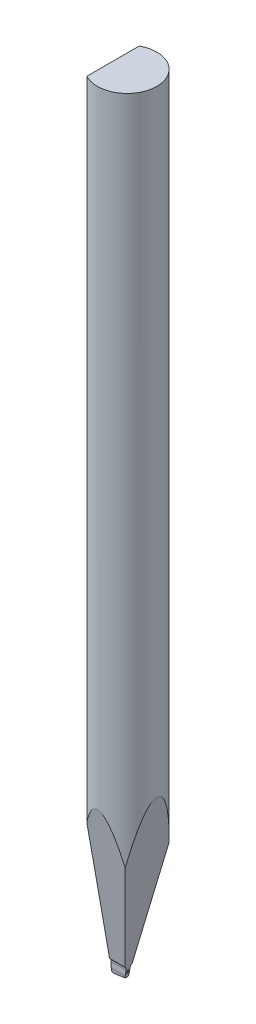
from build123d import *

# Parameters (mm, degrees)
TD_SKETCH_R                             = 0.79248
TL_FEATURE_DEPTH                        = 21.0312
TDF_STD_SKETCH_W                        = 2.09296
TDF_STD_SKETCH_H                        = 2.09296
TDF_STD_FEATURE_DEPTH                   = 22.061040395
ISA_20_STD_FEATURE_DEPTH                = 22.061040395
ISA_20_STD_FEATURE_DEPTH_BACK           = 22.061040395
VW_STD_FEATURE_DEPTH                    = 22.061040395
VW_STD_FEATURE_DEPTH_BACK               = 22.061040395
F_10BA_STD_FEATURE_DEPTH                = 22.061040503
F_10BA_STD_FEATURE_DEPTH_BACK           = 22.061040503
FRO_STD_FEATURE_DEPTH                   = 22.061040395
FRO_STD_FEATURE_DEPTH_BACK              = 22.061040395
C_STD_FEATURE_DEPTH                     = 22.061040395
C_STD_FEATURE_DEPTH_BACK                = 22.061040395
ERW_STD_FEATURE_DEPTH                   = 0.01905
H_STD_FEATURE_REACH                     = 22.896
H_STD_SKETCH_R                          = 0.01905
H_STD_SKETCH_3_R                        = 0.01905
FUNNEL_FINAL_DIAMETRE_STD_FEATURE_DEPTH = 2.499995
FUNNEL_FINAL_DIAMETRE_STD_FEATURE_DRAFT = -22.5
ROUND_BR_STD_FEATURE_START              = -1
ROUND_BR_STD_FEATURE_DEPTH              = 1.009339363


with BuildPart() as part:
    # TD_sketch → TL_feature (new body)
    with BuildSketch(Plane(origin=(0, 0, 0), x_dir=(1, 0, 0), z_dir=(0, 1, 0))):
        with Locations(Location((0, 0, 0), (0, 0, 270))):
            Circle(TD_SKETCH_R)
    extrude(amount=TL_FEATURE_DEPTH)

    # TDF_STD_sketch → TDF_STD_feature (cut, through all)
    with BuildSketch(Plane(origin=(0, 0, 0), x_dir=(1, 0, 0), z_dir=(0, 1, 0))):
        with Locations((-1.4224, 0)):
            Rectangle(TDF_STD_SKETCH_W, TDF_STD_SKETCH_H)
    extrude(amount=TDF_STD_FEATURE_DEPTH, mode=Mode.SUBTRACT)

    # ISA_20_STD_sketch → ISA_20_STD_feature (cut, two sides: drawn at the far end of the back side and taken through both)
    with BuildSketch(Plane(origin=(0, 0, 0), x_dir=(0, 0, -1), z_dir=(1, 0, 0)).offset(-ISA_20_STD_FEATURE_DEPTH_BACK)):
        Polygon((-12.946999885, 73.253224398), (-3.738847997, 21.0312), (-0.03048, 0), (0.03048, 0), (3.738847997, 21.0312), (12.946999885, 73.253224398), (12.946999885, -32.802042202), (-12.946999885, -32.802042202), align=None)
    extrude(amount=ISA_20_STD_FEATURE_DEPTH + ISA_20_STD_FEATURE_DEPTH_BACK, mode=Mode.SUBTRACT)

    # VW_STD_sketch → VW_STD_feature (cut, two sides: drawn at the far end of the back side and taken through both)
    with BuildSketch(Plane(origin=(0, 0, 0), x_dir=(0, 0, -1), z_dir=(1, 0, 0)).offset(-VW_STD_FEATURE_DEPTH_BACK)):
        with BuildLine():
            Line((-70.448918022, 70.704723144), (-20.775394878, 21.0312))
            Line((-20.775394878, 21.0312), (-0.087997439, 0.343802561))
            ThreePointArc((-0.087997439, 0.343802561), (-0.060467299, 0.302600796), (-0.0508, 0.254))
            Line((-0.0508, 0.254), (-0.0508, 0))
            Line((-0.0508, 0), (0.0508, 0))
            Line((0.0508, 0), (0.0508, 0.254))
            ThreePointArc((0.0508, 0.254), (0.060467299, 0.302600796), (0.087997439, 0.343802561))
            Line((0.087997439, 0.343802561), (20.775394878, 21.0312))
            Line((20.775394878, 21.0312), (70.448918022, 70.704723144))
            Line((70.448918022, 70.704723144), (70.448918022, -69.793217099))
            Line((70.448918022, -69.793217099), (-70.448918022, -69.793217099))
            Line((-70.448918022, -69.793217099), (-70.448918022, 70.704723144))
        make_face()
    extrude(amount=VW_STD_FEATURE_DEPTH + VW_STD_FEATURE_DEPTH_BACK, mode=Mode.SUBTRACT)

    # 10BA_STD_sketch → 10BA_STD_feature (cut, two sides: drawn at the far end of the back side and taken through both)
    with BuildSketch(Plane.XY.offset(-F_10BA_STD_FEATURE_DEPTH_BACK)):
        Polygon((-53.216424868, 0), (-0.37592, 0), (-0.29972, 0), (-0.011354365, 0.050846642), (3.688047997, 21.0312), (12.863705374, 73.068938867), (91.245890155, 2.183757568), (25.165759913, -70.885181299), align=None)
    extrude(amount=F_10BA_STD_FEATURE_DEPTH + F_10BA_STD_FEATURE_DEPTH_BACK, mode=Mode.SUBTRACT)

    # FRO_STD_sketch → FRO_STD_feature (cut, two sides: drawn at the far end of the back side and taken through both)
    with BuildSketch(Plane.XY.offset(-FRO_STD_FEATURE_DEPTH_BACK)):
        with BuildLine():
            Line((-0.37592, 52.152138388), (-0.37592, 0.02794))
            ThreePointArc((-0.37592, 0.02794), (-0.367736563, 0.008183437), (-0.34798, 0))
            Line((-0.34798, 0), (51.776218388, 0))
            Line((51.776218388, 0), (-21.9385299, -73.714748288))
            Line((-21.9385299, -73.714748288), (-74.090668288, -21.5626099))
            Line((-74.090668288, -21.5626099), (-0.37592, 52.152138388))
        make_face()
    extrude(amount=FRO_STD_FEATURE_DEPTH + FRO_STD_FEATURE_DEPTH_BACK, mode=Mode.SUBTRACT)

    # C_STD_sketch → C_STD_feature (cut, two sides: drawn at the far end of the back side and taken through both)
    with BuildSketch(Plane(origin=(0, 0, 0), x_dir=(0, 0, -1), z_dir=(1, 0, 0)).offset(-C_STD_FEATURE_DEPTH_BACK)):
        with BuildLine():
            Line((-50.530423385, -12.791040855), (-0.030559272, 0))
            ThreePointArc((-0.030559272, 0), (0, 0.00381), (0.030559272, 0))
            Line((0.030559272, 0), (50.530423385, -12.791040855))
            Line((50.530423385, -12.791040855), (50.530423385, -116.980234183))
            Line((50.530423385, -116.980234183), (-50.530423385, -116.980234183))
            Line((-50.530423385, -116.980234183), (-50.530423385, -12.791040855))
        make_face()
    extrude(amount=C_STD_FEATURE_DEPTH + C_STD_FEATURE_DEPTH_BACK, mode=Mode.SUBTRACT)


with BuildPart() as body_2:
    # ERW_STD_sketch → ERW_STD_feature (new, symmetric)
    with BuildSketch(Plane.XY):
        Polygon((-0.1397, 0.09144), (-0.1397, 0), (-0.32512, 0), (-0.272327091, 0.09144), align=None)
    extrude(amount=ERW_STD_FEATURE_DEPTH, both=True)

    # H_STD_sketch → H_STD_feature (add, up to next)
    with BuildSketch(Plane(origin=(-0.010897713, 0.165804035, 0), x_dir=(0, 0, -1), z_dir=(0.8660254037844415, 0.4999999999999953, 0)), mode=Mode.PRIVATE) as h_std_feature_sk1:
        with Locations(Location((0, 0, 0), (0, 0, 90))):
            Circle(H_STD_SKETCH_R)
    h_std_feature_tool1 = extrude(h_std_feature_sk1.sketch, amount=-H_STD_FEATURE_REACH, mode=Mode.PRIVATE) - body_2.part
    add(h_std_feature_tool1.solids().sort_by_distance((-0.010898, 0.165804, 0))[0])


with BuildPart() as funnel_final_diametre_std_feature_tool:
    # H_STD_sketch<3> → funnel_final_diametre_STD_feature (with draft: the straight prism first)
    with BuildSketch(Plane(origin=(-0.010897713, 0.165804035, 0), x_dir=(0, 0, -1), z_dir=(0.8660254037844415, 0.4999999999999953, 0))):
        with Locations(Location((0, 0, 0), (0, 0, 90))):
            Circle(H_STD_SKETCH_3_R)
    extrude(amount=FUNNEL_FINAL_DIAMETRE_STD_FEATURE_DEPTH)
    # funnel_final_diametre_STD_feature: the draft: its side faces are tilted about the plane it starts from
    funnel_final_diametre_std_feature_sides = [funnel_final_diametre_std_feature_tool.faces().sort_by_distance(p)[0] for p in [
        (1.081156877, 0.774305001, 0),
    ]]
    draft(funnel_final_diametre_std_feature_sides, Plane(origin=(-0.010897713, 0.165804035, 0), x_dir=(0, 0, -1), z_dir=(0.8660254037844415, 0.4999999999999953, 0)), FUNNEL_FINAL_DIAMETRE_STD_FEATURE_DRAFT)


with BuildPart() as body_2_1:
    add(body_2.part)

    # funnel_final_diametre_STD_feature: add funnel_final_diametre_std_feature_tool
    add(funnel_final_diametre_std_feature_tool.part)

    # ROUND_BR_STD_feature: read off the stored shape, not the designer's step
    # ROUND_BR_STD_feature outline → ROUND_BR_STD_feature (cut)
    with BuildSketch(Plane(origin=(0, 0, 0), x_dir=(0.8660254037844362, -0.5000000000000042, 0), z_dir=(0.5000000000000042, 0.8660254037844363, 0)).offset(ROUND_BR_STD_FEATURE_START)):
        with BuildLine():
            Line((-0.281562179, -0.01905), (-0.262512179, -0.01905))
            ThreePointArc((-0.262512179, -0.01905), (-0.275982563, -0.013470384), (-0.281562179, 0))
            Line((-0.281562179, 0), (-0.281562179, -0.01905))
        make_face()
        with BuildLine():
            Line((-0.281562179, 0.01905), (-0.281562179, 0))
            ThreePointArc((-0.281562179, 0), (-0.275982563, 0.013470384), (-0.262512179, 0.01905))
            Line((-0.262512179, 0.01905), (-0.281562179, 0.01905))
        make_face()
    extrude(amount=ROUND_BR_STD_FEATURE_DEPTH, mode=Mode.SUBTRACT)


with BuildPart() as part_1:
    add(part.part)

    # COMBINE_STD_feature: cut body 2
    add(body_2_1.part, mode=Mode.SUBTRACT)


solid = part_1.part
